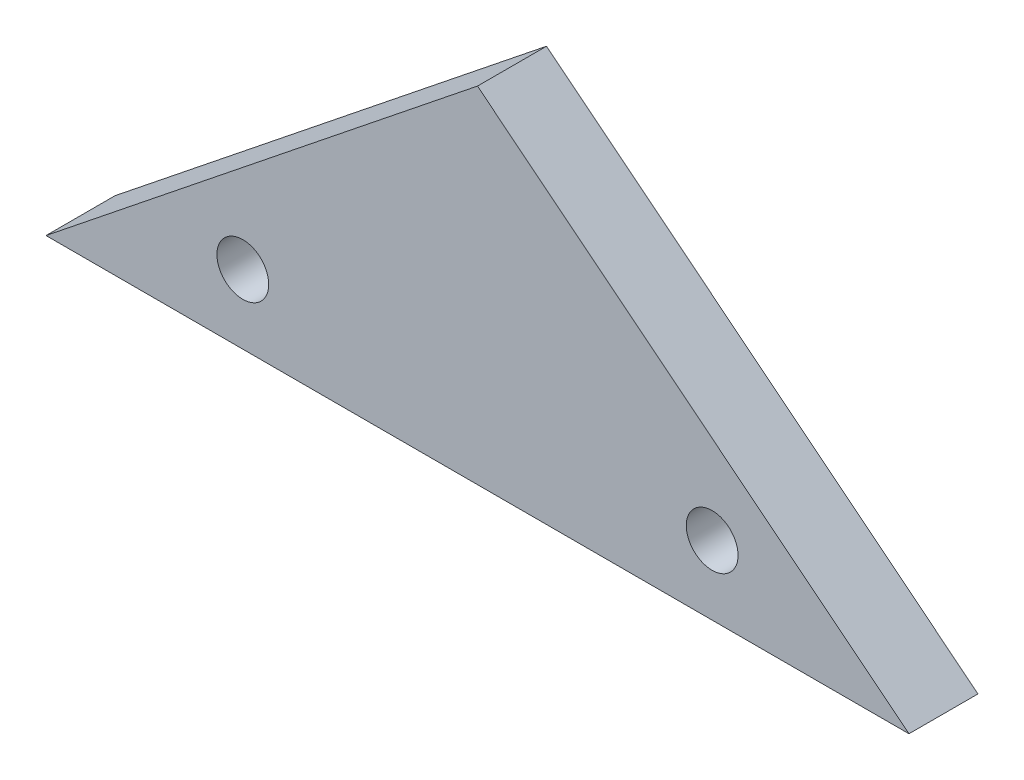
from build123d import *

# Parameters (mm, degrees)
BOSS_EXTRUDE1_DEPTH = 5.08
SKETCH2_R           = 1.905
CUT_EXTRUDE1_DEPTH  = 69.58


with BuildPart() as part:
    # Sketch1 → Boss-Extrude1 (new body)
    with BuildSketch(Plane.XY):
        Polygon((0, 0), (63.5, 0), (31.75, 25.4), align=None)
    extrude(amount=BOSS_EXTRUDE1_DEPTH)

    # Sketch2 → Cut-Extrude1 (cut, through all)
    with BuildSketch(Plane.XY.offset(5.08)):
        with Locations((14.481967782, 5.08)):
            Circle(SKETCH2_R)
        with Locations((49.018032218, 5.08)):
            Circle(SKETCH2_R)
    extrude(amount=-CUT_EXTRUDE1_DEPTH, mode=Mode.SUBTRACT)


solid = part.part
